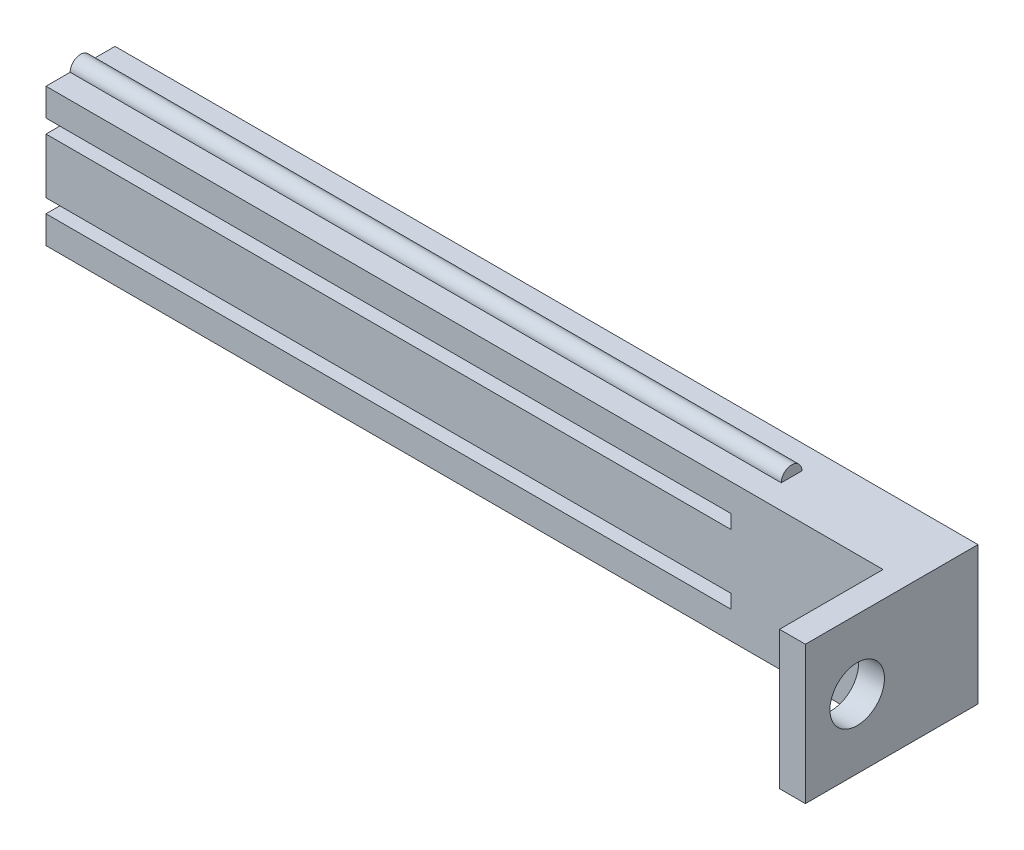
from build123d import *

# Parameters (mm, degrees)
SKETCH1_W           = 250
SKETCH1_H           = 40
BOSS_EXTRUDE1_DEPTH = 20
SKETCH2_W           = 7.5
SKETCH2_H           = 40
BOSS_EXTRUDE2_DEPTH = 30
BOSS_EXTRUDE3_DEPTH = 206
CUT_EXTRUDE1_DEPTH  = 198.5
SKETCH7_R           = 7.9
CUT_EXTRUDE2_DEPTH  = 258.764157926


with BuildPart() as part:
    # Sketch1 → Boss-Extrude1 (new body)
    with BuildSketch(Plane.XY):
        with Locations((-22.278734849, 48.666666667)):
            Rectangle(SKETCH1_W, SKETCH1_H)
    extrude(amount=BOSS_EXTRUDE1_DEPTH)

    # Sketch2 → Boss-Extrude2 (add)
    with BuildSketch(Plane.XY.offset(20)):
        with Locations((98.971265151, 48.666666667)):
            Rectangle(SKETCH2_W, SKETCH2_H)
    extrude(amount=BOSS_EXTRUDE2_DEPTH)

    # Sketch4 → Boss-Extrude3 (add)
    with BuildSketch(Plane.ZY.offset(147.278734849)):
        with BuildLine():
            Line((7, 68.666666667), (13, 68.666666667))
            ThreePointArc((13, 68.666666667), (10, 71.666666667), (7, 68.666666667))
        make_face()
        with BuildLine():
            Line((7, 28.666666667), (13, 28.666666667))
            ThreePointArc((13, 28.666666667), (10, 25.666666667), (7, 28.666666667))
        make_face()
    extrude(amount=-BOSS_EXTRUDE3_DEPTH)

    # Sketch6 → Cut-Extrude1 (cut)
    with BuildSketch(Plane.ZY.offset(147.278734849)):
        Polygon((20, 56.666666667), (20, 60.666666667), (15, 60.666666667), (15, 63.666666667), (10, 63.666666667), (10, 53.666666667), (15, 53.666666667), (15, 56.666666667), align=None)
        Polygon((20, 36.666666667), (20, 40.666666667), (15, 40.666666667), (15, 43.666666667), (10, 43.666666667), (10, 33.666666667), (15, 33.666666667), (15, 36.666666667), align=None)
    extrude(amount=-CUT_EXTRUDE1_DEPTH, mode=Mode.SUBTRACT)

    # Sketch7 → Cut-Extrude2 (cut, through all)
    with BuildSketch(Plane.ZY.offset(-95.221265151)):
        with Locations((35, 48.666666667)):
            Circle(SKETCH7_R)
    extrude(amount=-CUT_EXTRUDE2_DEPTH, mode=Mode.SUBTRACT)


solid = part.part
